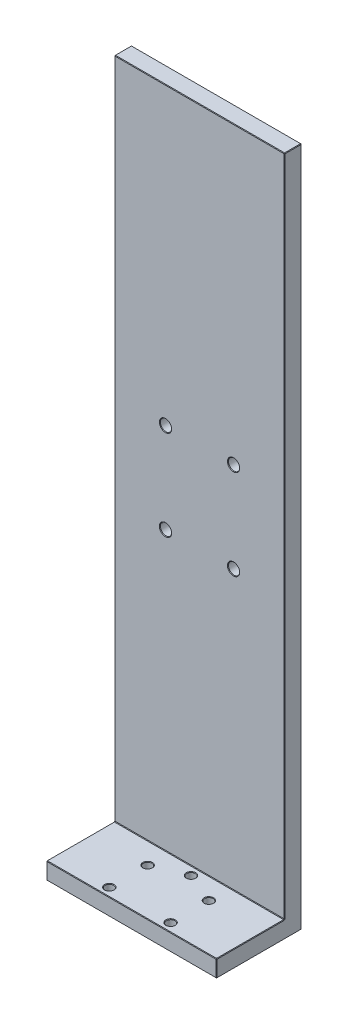
from build123d import *

# Parameters (mm, degrees)
BOSS_EXTRUDE1_DEPTH = 50
SKETCH2_R           = 3.3
CUT_EXTRUDE1_DEPTH  = 100
SKETCH3_R           = 2.5
CUT_EXTRUDE2_DEPTH  = 100
CHAMFER1_SIZE       = 0.3


with BuildPart() as part:
    # Sketch1 → Boss-Extrude1 (new, symmetric)
    with BuildSketch(Plane(origin=(0, 0, 0), x_dir=(0, 0, -1), z_dir=(1, 0, 0))):
        Polygon((0, 0), (0, 400), (-10, 400), (-10, 10), (-50, 10), (-50, 0), align=None)
    extrude(amount=BOSS_EXTRUDE1_DEPTH, both=True)

    # Sketch2 → Cut-Extrude1 (cut)
    with BuildSketch(Plane.XY.offset(10)):
        with Locations((-20, 226.5)):
            Circle(SKETCH2_R)
        with Locations((20, 226.5)):
            Circle(SKETCH2_R)
        with Locations((20, 173.5)):
            Circle(SKETCH2_R)
        with Locations((-20, 173.5)):
            Circle(SKETCH2_R)
    extrude(amount=-CUT_EXTRUDE1_DEPTH, mode=Mode.SUBTRACT)

    # Sketch3 → Cut-Extrude2 (cut)
    with BuildSketch(Plane(origin=(0, 10, 0), x_dir=(1, 0, 0), z_dir=(0, 1, 0))):
        with Locations((-18, -22.5)):
            Circle(SKETCH3_R)
        with Locations((-18, -45)):
            Circle(SKETCH3_R)
        with Locations((18, -45)):
            Circle(SKETCH3_R)
        with Locations((18, -22.5)):
            Circle(SKETCH3_R)
        with Locations((0, -15)):
            Circle(SKETCH3_R)
    extrude(amount=-CUT_EXTRUDE2_DEPTH, mode=Mode.SUBTRACT)

    # Chamfer1
    chamfer1_edges = [part.edges().sort_by_distance(p)[0] for p in [
        (-20.5, 10, 22.5),
        (-20.5, 10, 45),
        (15.5, 10, 45),
        (15.5, 10, 22.5),
        (-2.5, 10, 15),
        (-23.3, 226.5, 10),
        (16.7, 226.5, 10),
        (16.7, 173.5, 10),
        (-23.3, 173.5, 10),
        (50, 10, 30),
        (0, 10, 50),
        (-50, 10, 30),
        (0, 400, 10),
        (50, 205, 10),
        (0, 10, 10),
        (-50, 205, 10),
        (0, 0, 0),
        (0, 400, 0),
        (50, 5, 50),
        (50, 400, 5),
        (50, 200, 0),
        (50, 0, 25),
        (0, 0, 50),
        (-50, 5, 50),
        (-50, 400, 5),
        (-50, 200, 0),
        (-50, 0, 25),
        (-23.3, 226.5, 0),
        (16.7, 226.5, 0),
        (16.7, 173.5, 0),
        (-23.3, 173.5, 0),
        (-20.5, 0, 22.5),
        (-20.5, 0, 45),
        (15.5, 0, 45),
        (15.5, 0, 22.5),
        (-2.5, 0, 15),
    ]]
    chamfer(chamfer1_edges, length=CHAMFER1_SIZE)


solid = part.part
